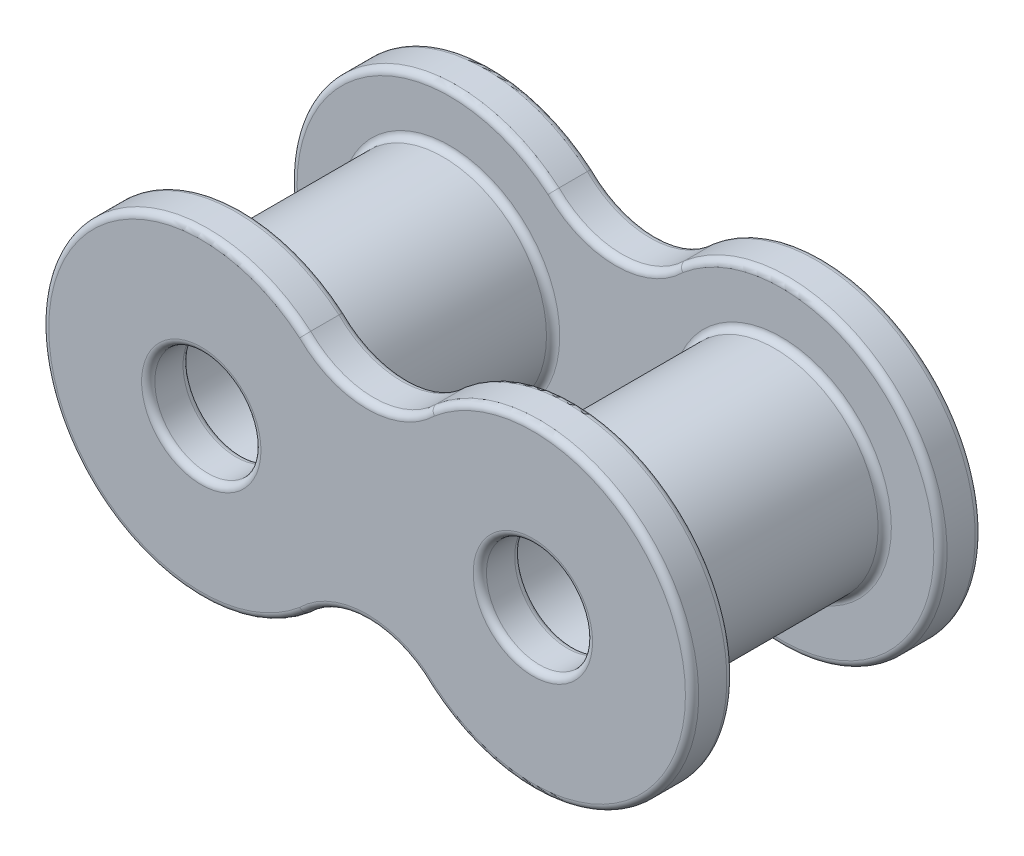
from build123d import *

# Parameters (mm, degrees)
BOSS_EXTRUDE2_DEPTH = 1.5875
FILLET10_3_ANGLE    = 260.487273
FILLET10_4_ANGLE    = 90.000003
FILLET10_5_ANGLE    = 90.000003
FILLET10_6_ANGLE    = 260.487273
SKETCH2_R           = 3.9624
SKETCH2_R_2         = 2.286
BOSS_EXTRUDE3_DEPTH = 7.9248
FILLET11_R          = 0.254


with BuildPart() as part:
    # Sketch1 → Boss-Extrude2 (new body)
    with BuildSketch(Plane.XY):
        with BuildLine():
            ThreePointArc((-2.41174508, 4.653102641), (-8.914528612, 5.53031726), (-12.446, 0))
            Line((-12.446, 0), (-8.382, 0))
            ThreePointArc((-8.382, 0), (-6.35, 2.032), (-4.318, 0))
            Line((-4.318, 0), (0, 0))
            Line((0, 0), (0, 3.65412512))
            ThreePointArc((0, 3.65412512), (-1.305227032, 3.913750918), (-2.41174508, 4.653102641))
        make_face()
        with BuildLine():
            Line((-8.382, 0), (-12.446, 0))
            ThreePointArc((-12.446, 0), (-8.914528612, -5.53031726), (-2.41174508, -4.653102641))
            ThreePointArc((-2.41174508, -4.653102641), (-1.305227032, -3.913750918), (0, -3.65412512))
            Line((0, -3.65412512), (0, 0))
            Line((0, 0), (-4.318, 0))
            ThreePointArc((-4.318, 0), (-6.35, -2.032), (-8.382, 0))
        make_face()
        with BuildLine():
            Line((0, 0), (0, -3.65412512))
            ThreePointArc((0, -3.65412512), (1.305227032, -3.913750918), (2.41174508, -4.653102641))
            ThreePointArc((2.41174508, -4.653102641), (8.914528612, -5.53031726), (12.446, 0))
            Line((12.446, 0), (8.382, 0))
            ThreePointArc((8.382, 0), (6.35, -2.032), (4.318, 0))
            Line((4.318, 0), (0, 0))
        make_face()
        with BuildLine():
            ThreePointArc((2.41174508, 4.653102641), (1.305227032, 3.913750918), (0, 3.65412512))
            Line((0, 3.65412512), (0, 0))
            Line((0, 0), (4.318, 0))
            ThreePointArc((4.318, 0), (6.35, 2.032), (8.382, 0))
            Line((8.382, 0), (12.446, 0))
            ThreePointArc((12.446, 0), (8.914528612, 5.53031726), (2.41174508, 4.653102641))
        make_face()
    boss_extrude2 = extrude(amount=BOSS_EXTRUDE2_DEPTH)

    # Fillet10: read off the stored shape, not the designer's step
    # Fillet10 outline → Fillet10 (revolve, cut)
    with BuildSketch(Plane(origin=(-6.35, 0, 0), x_dir=(1, 0, 0), z_dir=(0, -1, 0))):
        with BuildLine():
            ThreePointArc((2.032, 1.3335), (2.106394878, 1.513105122), (2.286, 1.5875))
            Line((2.286, 1.5875), (2.032, 1.5875))
            Line((2.032, 1.5875), (2.032, 1.3335))
        make_face()
        with BuildLine():
            ThreePointArc((2.286, 0), (2.106394878, 0.074394878), (2.032, 0.254))
            Line((2.032, 0.254), (2.032, 0))
            Line((2.032, 0), (2.286, 0))
        make_face()
    revolve(axis=Axis((-6.35, 0, 0), (0, 0, 1)), mode=Mode.SUBTRACT)

    # Fillet10 2 outline → Fillet10 2 (revolve, cut)
    with BuildSketch(Plane(origin=(6.35, 0, 0), x_dir=(1, 0, 0), z_dir=(0, -1, 0))):
        with BuildLine():
            ThreePointArc((2.032, 1.3335), (2.106394878, 1.513105122), (2.286, 1.5875))
            Line((2.286, 1.5875), (2.032, 1.5875))
            Line((2.032, 1.5875), (2.032, 1.3335))
        make_face()
        with BuildLine():
            Line((2.032, 0), (2.286, 0))
            ThreePointArc((2.286, 0), (2.106394878, 0.074394878), (2.032, 0.254))
            Line((2.032, 0.254), (2.032, 0))
        make_face()
    revolve(axis=Axis((6.35, 0, 0), (0, 0, 1)), mode=Mode.SUBTRACT)

    # Fillet10 3 outline → Fillet10 3 (revolve, cut)
    with BuildSketch(Plane(origin=(6.35, 0, 0), x_dir=(-0.6460392084874156, -0.7633042257821934, 0), z_dir=(-0.7633042257821934, 0.6460392084874156, 0))):
        with BuildLine():
            ThreePointArc((5.842, 1.5875), (6.021605122, 1.513105122), (6.096, 1.3335))
            Line((6.096, 1.3335), (6.096, 1.5875))
            Line((6.096, 1.5875), (5.842, 1.5875))
        make_face()
        with BuildLine():
            Line((6.096, 0), (6.096, 0.254))
            ThreePointArc((6.096, 0.254), (6.021605122, 0.074394878), (5.842, 0))
            Line((5.842, 0), (6.096, 0))
        make_face()
    revolve(axis=Axis((6.35, 0, 0), (0, 0, 1)), revolution_arc=FILLET10_3_ANGLE, mode=Mode.SUBTRACT)

    # Fillet10 4 outline → Fillet10 4 (revolve, cut)
    with BuildSketch(Plane(origin=(0, 7.06484772, 0), x_dir=(-0.7071067999194189, -0.7071067624536757, 0), z_dir=(-0.7071067624536757, 0.7071067999194189, 0))):
        with BuildLine():
            ThreePointArc((3.410722601, 1.3335), (3.485117479, 1.513105122), (3.664722601, 1.5875))
            Line((3.664722601, 1.5875), (3.410722601, 1.5875))
            Line((3.410722601, 1.5875), (3.410722601, 1.3335))
        make_face()
        with BuildLine():
            ThreePointArc((3.664722601, 0), (3.485117479, 0.074394878), (3.410722601, 0.254))
            Line((3.410722601, 0.254), (3.410722601, 0))
            Line((3.410722601, 0), (3.664722601, 0))
        make_face()
    revolve(axis=Axis((0, 7.06484772, 0), (0, 0, 1)), revolution_arc=FILLET10_4_ANGLE, mode=Mode.SUBTRACT)

    # Fillet10 5 outline → Fillet10 5 (revolve, cut)
    with BuildSketch(Plane(origin=(0, -7.06484772, 0), x_dir=(0.7071067999194194, 0.7071067624536752, 0), z_dir=(0.7071067624536752, -0.7071067999194194, 0))):
        with BuildLine():
            ThreePointArc((3.410722601, 1.3335), (3.485117479, 1.513105122), (3.664722601, 1.5875))
            Line((3.664722601, 1.5875), (3.410722601, 1.5875))
            Line((3.410722601, 1.5875), (3.410722601, 1.3335))
        make_face()
        with BuildLine():
            ThreePointArc((3.664722601, 0), (3.485117479, 0.074394878), (3.410722601, 0.254))
            Line((3.410722601, 0.254), (3.410722601, 0))
            Line((3.410722601, 0), (3.664722601, 0))
        make_face()
    revolve(axis=Axis((0, -7.06484772, 0), (0, 0, 1)), revolution_arc=FILLET10_5_ANGLE, mode=Mode.SUBTRACT)

    # Fillet10 6 outline → Fillet10 6 (revolve, cut)
    with BuildSketch(Plane(origin=(-6.35, 0, 0), x_dir=(0.646039208487415, 0.7633042257821938, 0), z_dir=(0.7633042257821938, -0.646039208487415, 0))):
        with BuildLine():
            ThreePointArc((5.842, 1.5875), (6.021605122, 1.513105122), (6.096, 1.3335))
            Line((6.096, 1.3335), (6.096, 1.5875))
            Line((6.096, 1.5875), (5.842, 1.5875))
        make_face()
        with BuildLine():
            Line((6.096, 0), (6.096, 0.254))
            ThreePointArc((6.096, 0.254), (6.021605122, 0.074394878), (5.842, 0))
            Line((5.842, 0), (6.096, 0))
        make_face()
    revolve(axis=Axis((-6.35, 0, 0), (0, 0, 1)), revolution_arc=FILLET10_6_ANGLE, mode=Mode.SUBTRACT)

    # Sketch2 → Boss-Extrude3 (add)
    with BuildSketch(Plane(origin=(0, 0, 0), x_dir=(-1, 0, 0), z_dir=(0, 0, -1))):
        with Locations(Location((-6.35, 0, 0), (0, 0, 180))):
            Circle(SKETCH2_R)
        with Locations(Location((-6.35, 0, 0), (0, 0, 180))):
            Circle(SKETCH2_R_2, mode=Mode.SUBTRACT)
    boss_extrude3 = extrude(amount=BOSS_EXTRUDE3_DEPTH)

    # Mirror1: Boss-Extrude3 across plane
    add(boss_extrude3.mirror(Plane(origin=(0, 0, 0), x_dir=(0, 0, 1), z_dir=(1, 0, 0))))

    # Mirror4: Boss-Extrude2 across plane
    add(boss_extrude2.mirror(Plane(origin=(0, 0, -3.9624), x_dir=(1, 0, 0), z_dir=(0, 0, -1))))

    # Fillet11
    fillet11_edges = [part.edges().sort_by_distance(p)[0] for p in [
        (2.3876, 0, -7.9248),
        (0, 3.65412512, -7.9248),
        (-12.446, 0, -7.9248),
        (-2.3876, 0, -7.9248),
        (0, -3.65412512, -7.9248),
        (-12.446, 0, -9.5123),
        (0, 3.65412512, -9.5123),
        (12.446, 0, -7.9248),
        (4.318, 0, -9.5123),
        (0, -3.65412512, -9.5123),
        (12.446, 0, -9.5123),
        (-8.382, 0, -9.5123),
    ]]
    fillet(fillet11_edges, radius=FILLET11_R)


solid = part.part
